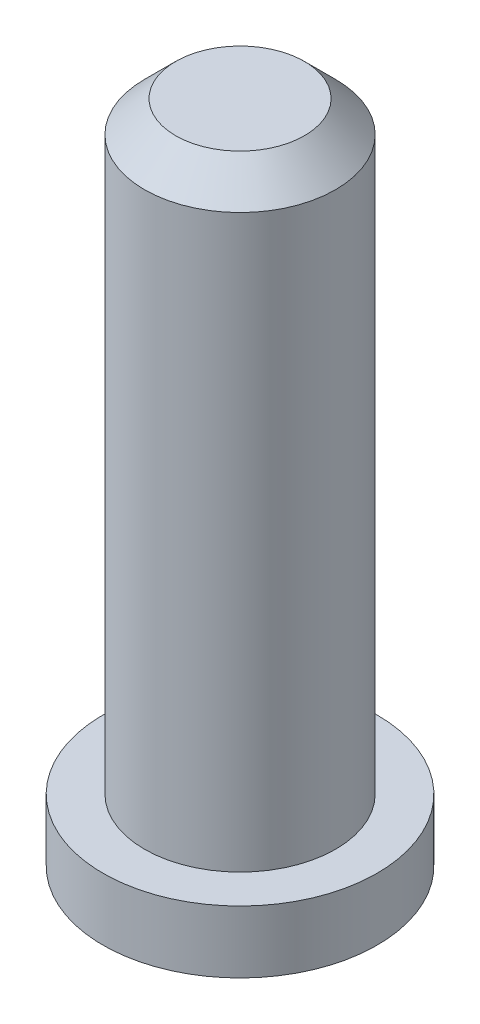
from build123d import *

# Parameters (mm, degrees)
CHAMFER1_SIZE = 0.75


with BuildPart() as part:
    # Sketch1 → Revolve1 (revolve)
    with BuildSketch(Plane.XY):
        Polygon((0, 16), (2.3, 16), (2.3, 1.5), (3.3, 1.5), (3.3, 0), (0, 0), align=None)
    revolve(axis=Axis((0, 0, 0), (0, 1, 0)))

    # Chamfer1
    chamfer1_edges = [part.edges().sort_by_distance(p)[0] for p in [
        (-2.3, 16, 0),
    ]]
    chamfer(chamfer1_edges, length=CHAMFER1_SIZE)


solid = part.part
